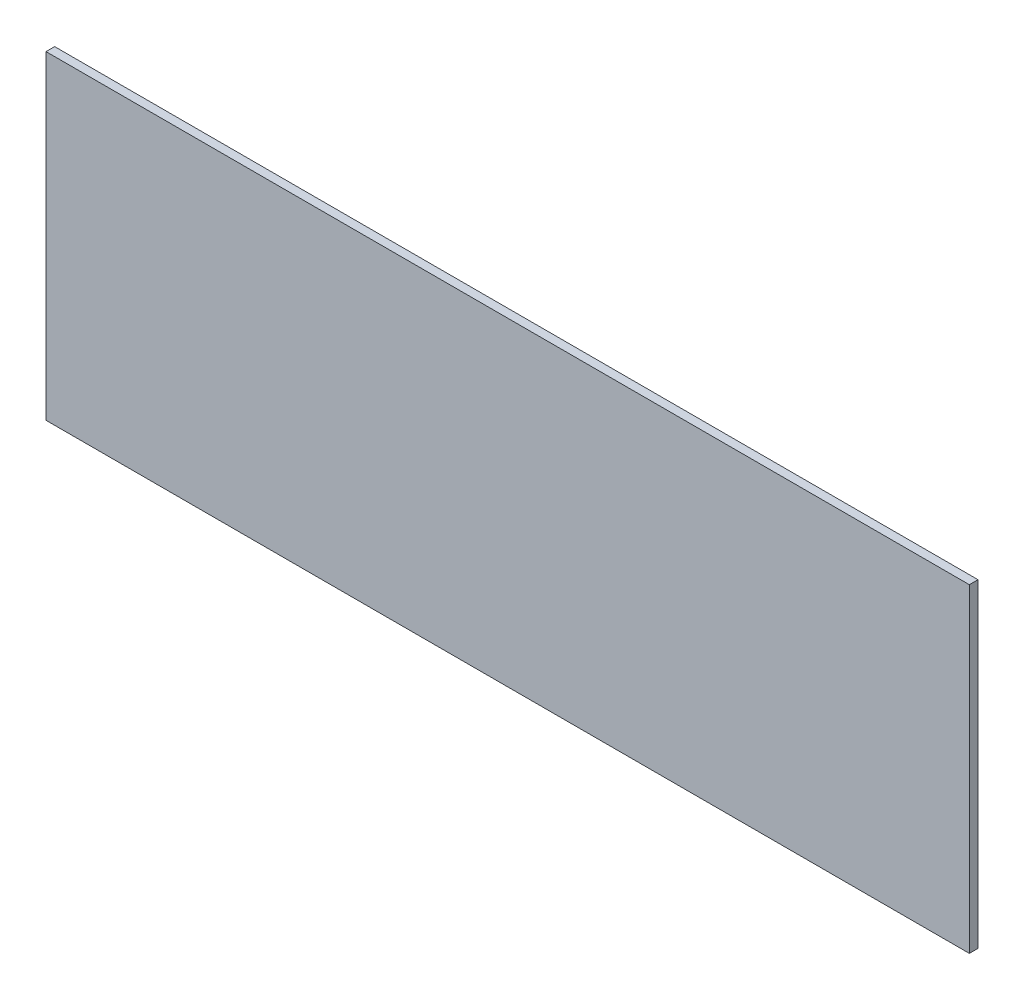
from build123d import *

# Parameters (mm, degrees)
SKETCH1_W           = 960
SKETCH1_H           = 332
BOSS_EXTRUDE1_DEPTH = 9


with BuildPart() as part:
    # Sketch1 → Boss-Extrude1 (new body)
    with BuildSketch(Plane.XY):
        Rectangle(SKETCH1_W, SKETCH1_H)
    extrude(amount=BOSS_EXTRUDE1_DEPTH)


solid = part.part
